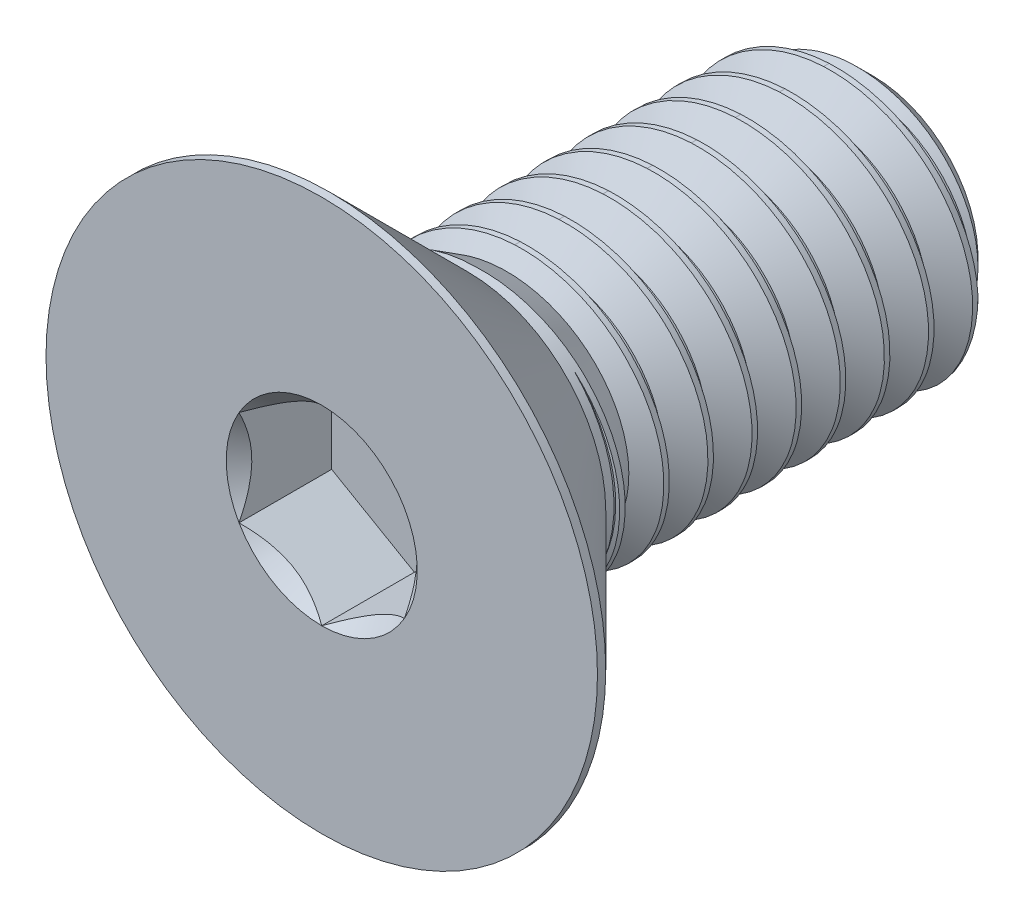
from build123d import *

# Parameters (mm, degrees)
CUT_EXTRUDE2_DEPTH = 1.68
SKETCH6_R          = 1.732050808
CUT_EXTRUDE3_DEPTH = 1.68
CUT_EXTRUDE3_TAPER = 45
CUT_SWEEP1_PITCH   = 0.8
CUT_SWEEP1_TO      = 7.2


with BuildPart() as part:
    # Sketch7 → Revolve2 (revolve)
    with BuildSketch(Plane(origin=(0, 0, 0), x_dir=(0, 0, -1), z_dir=(1, 0, 0))):
        Polygon((-2.8, 0), (-2.8, 5), (-2.65, 5), (-0.15, 2.5), (6.6, 2.5), (7.2, 1.9), (7.2, 0), align=None)
    revolve(axis=Axis((0, 0, -7.2), (0, 0, 1)))

    # Sketch5 → Cut-Extrude2 (cut)
    with BuildSketch(Plane.XY.offset(2.8)):
        Polygon((1.5, -0.866025404), (1.5, 0.866025404), (0, 1.732050808), (-1.5, 0.866025404), (-1.5, -0.866025404), (0, -1.732050808), align=None)
    extrude(amount=-CUT_EXTRUDE2_DEPTH, mode=Mode.SUBTRACT)

    # Sketch6 → Cut-Extrude3 (cut)
    with BuildSketch(Plane.XY.offset(2.8)):
        Circle(SKETCH6_R)
    extrude(amount=-CUT_EXTRUDE3_DEPTH, taper=CUT_EXTRUDE3_TAPER, mode=Mode.SUBTRACT)


with BuildPart() as body_2:
    # Split1: the piece on the far side of the plane
    add(part.part)
    split(bisect_by=Plane.XY, keep=Keep.BOTTOM)

    # Cut-Sweep1: arcs per turn and ends read off the stored shape
    # Cut-Sweep1: the profile of Sketch8 screwed along a right-hand helix through 10 turns, 8 arcs to a turn; built about Z, then put on its axis
    cut_sweep1_z = Axis((0, 0, 0), (0, 0, 1))
    cut_sweep1_corners = [(2.54330127, 0, 0.025), (2.54330127, 0, -0.725), (1.980384758, 0, -0.4), (1.980384758, 0, -0.3)]
    with BuildLine(mode=Mode.PRIVATE) as cut_sweep1_profile:
        Line(cut_sweep1_corners[0], cut_sweep1_corners[1])
        Line(cut_sweep1_corners[1], cut_sweep1_corners[2])
        Line(cut_sweep1_corners[2], cut_sweep1_corners[3])
        Line(cut_sweep1_corners[3], cut_sweep1_corners[0])
    cut_sweep1_cap = Face(cut_sweep1_profile.wire())
    cut_sweep1_turn_angles = [0, 22.5, 45, 67.5, 90, 112.5, 135, 157.5, 180, 202.5, 225, 247.5, 270, 292.5, 315, 337.5, 360]
    cut_sweep1_turn_weights = [1, 0.9238795325112867, 1, 0.9238795325112867, 1, 0.9238795325112867, 1, 0.9238795325112867, 1, 0.9238795325112867, 1, 0.9238795325112867, 1, 0.9238795325112867, 1, 0.9238795325112867, 1]
    cut_sweep1_turn_rails = [Edge.make_bspline([Vector(p[0], p[1], 0).rotate(cut_sweep1_z, cut_sweep1_turn_angles[k]) / cut_sweep1_turn_weights[k] + Vector(0, 0, p[2] + CUT_SWEEP1_PITCH * cut_sweep1_turn_angles[k] / 360) for k in range(17)], [0, 0, 0, 1, 1, 2, 2, 3, 3, 4, 4, 5, 5, 6, 6, 7, 7, 8, 8, 8], 2, cut_sweep1_turn_weights) for p in cut_sweep1_corners]
    cut_sweep1_turn_sides = [Face.make_surface_from_curves(cut_sweep1_turn_rails[p[0]], cut_sweep1_turn_rails[p[1]]) for p in [(0, 1), (1, 2), (2, 3), (3, 0)]]
    cut_sweep1 = Plane(origin=(0, 0, -7.2), x_dir=(0, 1, 0), z_dir=(0, 0, 1)) * split(Solid(Shell([*[p.moved(Location((0, 0, CUT_SWEEP1_PITCH * i))) for i in range(10) for p in cut_sweep1_turn_sides], cut_sweep1_cap, cut_sweep1_cap.rotate(cut_sweep1_z, 3600).moved(Location((0, 0, CUT_SWEEP1_PITCH * 3600 / 360)))])), bisect_by=Plane.XY.offset(CUT_SWEEP1_TO), keep=Keep.BOTTOM, mode=Mode.PRIVATE)
    add(cut_sweep1, mode=Mode.SUBTRACT)


with BuildPart() as part_1:
    add(part.part)

    # Split1
    split(bisect_by=Plane.XY, keep=Keep.TOP)

    add(body_2.part)  # Boss-Extrude1 merges body 2
    # Boss-Extrude1 cone 1 section (through the dimple's axis) → Boss-Extrude1 (revolve)
    with BuildSketch(Plane(origin=(0, 0, 0), x_dir=(0, -1, 0), z_dir=(1, 0, 0))):
        Polygon((0, 0), (2.5, 0), (0, 4.177195611), align=None)
    revolve(axis=Axis((0, 0, 0), (0, 0, -1)))


solid = part_1.part
